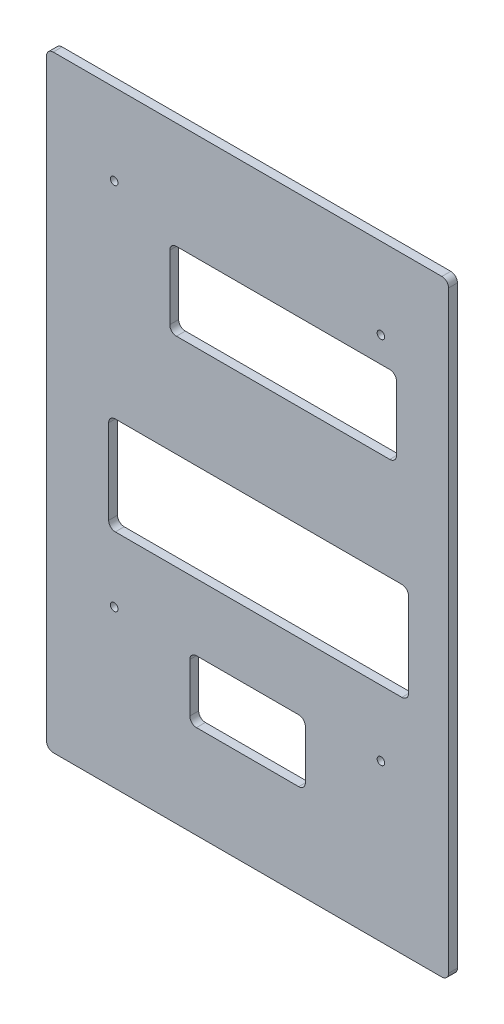
from build123d import *

# Parameters (mm, degrees)
ESQUISSE1_W             = 180.86
ESQUISSE1_H             = 273
ESQUISSE1_R             = 1.5
ESQUISSE1_W_2           = 52
ESQUISSE1_H_2           = 28
ESQUISSE1_W_3           = 134.93
ESQUISSE1_H_3           = 44
ESQUISSE1_W_4           = 102
ESQUISSE1_H_4           = 35
BOSS_EXTRU_1_DEPTH      = 4
D_GAGEMENT_M31_D        = 3.4
CONG_1_R                = 3
ESQUISSE5_R             = 2.37073369
ENL_V_MAT_EXTRU_2_DEPTH = 1


with BuildPart() as part:
    # Esquisse1 → Boss.-Extru.1 (new body)
    with BuildSketch(Plane.XY):
        with Locations((90.43, 136.5)):
            Rectangle(ESQUISSE1_W, ESQUISSE1_H)
        with Locations((30.43, 236.5)):
            Circle(ESQUISSE1_R, mode=Mode.SUBTRACT)
        with Locations((150.43, 236.5)):
            Circle(ESQUISSE1_R, mode=Mode.SUBTRACT)
        with Locations((30.43, 70.5)):
            Circle(ESQUISSE1_R, mode=Mode.SUBTRACT)
        with Locations((150.43, 70.5)):
            Circle(ESQUISSE1_R, mode=Mode.SUBTRACT)
        with Locations((90.43, 56)):
            Rectangle(ESQUISSE1_W_2, ESQUISSE1_H_2, mode=Mode.SUBTRACT)
        with Locations((95.395, 122)):
            Rectangle(ESQUISSE1_W_3, ESQUISSE1_H_3, mode=Mode.SUBTRACT)
        with Locations((106.43, 207.5)):
            Rectangle(ESQUISSE1_W_4, ESQUISSE1_H_4, mode=Mode.SUBTRACT)
    extrude(amount=BOSS_EXTRU_1_DEPTH)

    # Dégagement M31 (through all)
    with Locations(Plane.XY.offset(4)):
        with Locations((30.43, 236.5), (150.43, 236.5), (150.43, 70.5), (30.43, 70.5)):
            Hole(D_GAGEMENT_M31_D / 2)

    # Congé1
    cong_1_edges = [part.edges().sort_by_distance(p)[0] for p in [
        (0, 0, 2),
        (180.86, 0, 2),
        (116.43, 42, 2),
        (64.43, 42, 2),
        (116.43, 70, 2),
        (64.43, 70, 2),
        (162.86, 100, 2),
        (27.93, 100, 2),
        (162.86, 144, 2),
        (27.93, 144, 2),
        (180.86, 273, 2),
        (0, 273, 2),
        (157.43, 190, 2),
        (157.43, 225, 2),
        (55.43, 225, 2),
        (55.43, 190, 2),
    ]]
    fillet(cong_1_edges, radius=CONG_1_R)

    # Esquisse5 → Enlèv. mat.-Extru.2 (cut)
    # profile 1 of 11: a face of its own
    with BuildSketch(Plane(origin=(0, 0, 0), x_dir=(-1, 0, 0), z_dir=(0, 0, -1))):
        Polygon((-94.283346835, 174.034677194), (-91.185169292, 174.034677194), (-91.182359598, 166.790649968), (-88.077554099, 170.336852385), (-84.69677529, 170.336852385), (-88.331818801, 166.259366774), (-84.453541471, 160.018398975), (-87.922812939, 160.018398975), (-90.427752118, 164.343168722), (-91.182359598, 163.827233749), (-91.182359598, 160.018398975), (-94.283346835, 160.018398975), align=None)
    # profile 2 of 11: a face of its own
    with BuildSketch(Plane(origin=(0, 0, 0), x_dir=(-1, 0, 0), z_dir=(0, 0, -1))):
        with BuildLine():
            Line((-78.792459122, 174.034677194), (-75.689252185, 174.034677194))
            Line((-75.689252185, 174.034677194), (-75.689252185, 169.149539362))
            add(Edge.make_bspline(
                [(-75.689252185, 169.149539362), (-75.259442931, 169.759749882), (-73.910117231, 170.528137365), (-70.907930579, 170.723106308), (-69.542099901, 168.641576988), (-69.526370215, 167.438557264)],
                knots=[0, 0, 0, 0, 0.262740623, 0.558365338, 1, 1, 1, 1], degree=3))
            Line((-69.526370215, 167.438557264), (-69.526370215, 160.018398975))
            Line((-69.526370215, 160.018398975), (-72.624885356, 160.018398975))
            Line((-72.624885356, 160.018398975), (-72.624885356, 166.790649968))
            add(Edge.make_bspline(
                [(-75.694281579, 165.950650474), (-75.607046533, 166.608895098), (-75.198613544, 167.568039344), (-73.608769863, 168.496367369), (-72.525461974, 167.521061969), (-72.624885356, 166.790649968)],
                knots=[0, 0, 0, 0, 0.39454131, 0.596070008, 1, 1, 1, 1], degree=3))
            Line((-75.694281579, 165.950650474), (-75.694281579, 160.018398975))
            Line((-75.694281579, 160.018398975), (-78.792459122, 160.018398975))
            Line((-78.792459122, 160.018398975), (-78.792459122, 174.034677194))
        make_face()
    # profile 3 of 11: a face of its own
    with BuildSketch(Plane(origin=(0, 0, 0), x_dir=(-1, 0, 0), z_dir=(0, 0, -1))):
        with BuildLine():
            Line((-139.256891809, 172.935323872), (-137.158126377, 172.935323872))
            Line((-137.158126377, 172.935323872), (-137.158126377, 170.436793596))
            Line((-137.158126377, 170.436793596), (-133.673463028, 170.436793596))
            Line((-133.673463028, 170.436793596), (-133.673463028, 168.138145742))
            Line((-133.673463028, 168.138145742), (-137.158126377, 168.138145742))
            Line((-137.158126377, 168.138145742), (-137.158126377, 162.870364156))
            add(Edge.make_bspline(
                [(-137.158126377, 162.870364156), (-137.135735133, 162.620457218), (-136.829841883, 162.329297605), (-135.45963159, 161.948909237), (-134.22981955, 162.30663317), (-133.27943708, 162.541437923)],
                knots=[0, 0, 0, 0, 0.163675361, 0.277490049, 1, 1, 1, 1], degree=3))
            Line((-133.27943708, 162.541437923), (-133.27943708, 160.242790069))
            add(Edge.make_bspline(
                [(-133.27943708, 160.242790069), (-134.814099805, 160.050957228), (-138.701915147, 159.232331269), (-139.675674588, 161.34214339), (-139.808114513, 161.629096562), (-139.94978442, 161.926620231), (-139.975498221, 162.24161429), (-140.135507958, 164.201733563), (-140.072016369, 166.174224534), (-140.175380643, 168.138145742)],
                knots=[0, 0, 0, 0, 1, 1, 1, 2, 2, 2, 3, 3, 3, 3], degree=3))
            Line((-140.175380643, 168.138145742), (-141.753204023, 168.138145742))
            Line((-141.753204023, 168.138145742), (-141.753204023, 170.336852385))
            Line((-141.753204023, 170.336852385), (-140.023860949, 170.336852385))
            Line((-140.023860949, 170.336852385), (-139.256891809, 172.935323872))
        make_face()
    # profile 4 of 11: a face of its own
    with BuildSketch(Plane(origin=(0, 0, 0), x_dir=(-1, 0, 0), z_dir=(0, 0, -1))):
        with BuildLine():
            Line((-12.931201039, 172.935323872), (-10.932376817, 172.835382661))
            Line((-10.932376817, 172.835382661), (-10.832435606, 170.436793596))
            Line((-10.832435606, 170.436793596), (-7.434434431, 170.436793596))
            Line((-7.434434431, 170.436793596), (-7.434434431, 168.138145742))
            Line((-7.434434431, 168.138145742), (-10.932376817, 168.138145742))
            Line((-10.932376817, 168.138145742), (-10.832435606, 162.541437923))
            add(Edge.make_bspline(
                [(-7.034669586, 162.441496712), (-7.800572606, 162.237765999), (-9.055924893, 162.128236657), (-10.454489022, 162.072852708), (-10.832435606, 162.541437923)],
                knots=[0, 0, 0, 0, 0.590901675, 1, 1, 1, 1], degree=3))
            Line((-7.034669586, 162.441496712), (-7.034669586, 160.242790069))
            add(Edge.make_bspline(
                [(-7.034669586, 160.242790069), (-8.624443953, 160.067625406), (-12.469864417, 159.308373099), (-13.414156851, 161.435507228), (-13.623994546, 161.908192286), (-13.782004231, 162.4232356), (-13.791969329, 162.940307858), (-13.825996528, 164.705922314), (-13.806980244, 166.472160588), (-13.814485702, 168.238086953)],
                knots=[0, 0, 0, 0, 1, 1, 1, 2, 2, 2, 3, 3, 3, 3], degree=3))
            Line((-13.814485702, 168.238086953), (-15.440621885, 168.238086953))
            Line((-15.440621885, 168.238086953), (-15.440621885, 170.436793596))
            Line((-15.440621885, 170.436793596), (-13.716472945, 170.436793596))
            Line((-13.716472945, 170.436793596), (-12.931201039, 172.935323872))
        make_face()
    # profile 5 of 11: a face of its own
    with BuildSketch(Plane(origin=(0, 0, 0), x_dir=(-1, 0, 0), z_dir=(0, 0, -1))):
        Polygon((-174.236315677, 172.835382661), (-163.638100396, 172.835382661), (-163.638100396, 170.233513434), (-167.332675309, 170.233513434), (-167.332675309, 160.018398975), (-170.52219302, 160.018398975), (-170.570325513, 170.233513434), (-174.236315677, 170.233513434), align=None)
    # profile 6 of 11: a face of its own
    with BuildSketch(Plane(origin=(0, 0, 0), x_dir=(-1, 0, 0), z_dir=(0, 0, -1))):
        with BuildLine():
            Line((-47.213493181, 160.06614185), (-47.213493181, 172.835382661))
            Line((-47.213493181, 172.835382661), (-41.519185643, 172.835382661))
            add(Edge.make_bspline(
                [(-39.528607541, 166.790649968), (-38.956489083, 166.948005768), (-38.237437626, 167.683242131), (-37.896820407, 168.973263869), (-37.811326567, 170.127809871), (-38.284767117, 171.257641656), (-39.479973382, 172.391122107), (-40.692099064, 172.776713978), (-41.519185643, 172.835382661)],
                knots=[0, 0, 0, 0, 0.199158379, 0.317574937, 0.451003297, 0.584990763, 0.718220369, 1, 1, 1, 1], degree=3))
            add(Edge.make_bspline(
                [(-40.669958921, 160.06614185), (-39.736727743, 160.157652535), (-38.480391966, 160.846771809), (-37.259453131, 162.342559511), (-37.170137797, 163.667458124), (-37.174288807, 165.538002607), (-38.716644404, 166.479395874), (-39.528607541, 166.790649968)],
                knots=[0, 0, 0, 0, 0.282707491, 0.435580188, 0.571415841, 0.685536499, 1, 1, 1, 1], degree=3))
            Line((-40.669958921, 160.06614185), (-47.213493181, 160.06614185))
        make_face()
        with BuildLine():
            Line((-44.008657035, 167.93826332), (-44.008657035, 170.336852385))
            Line((-44.008657035, 170.336852385), (-42.174298778, 170.336852385))
            add(Edge.make_bspline(
                [(-42.049794824, 167.93826332), (-41.669827031, 167.927070476), (-41.248589309, 168.346380324), (-41.07437401, 169.11731054), (-41.21655482, 169.96394874), (-41.825514646, 170.299249739), (-42.174298778, 170.336852385)],
                knots=[0, 0, 0, 0, 0.294874779, 0.472371571, 0.685290478, 1, 1, 1, 1], degree=3))
            Line((-42.049794824, 167.93826332), (-44.008657035, 167.93826332))
        make_face(mode=Mode.SUBTRACT)
        with BuildLine():
            Line((-44.026733029, 165.464806319), (-44.026733029, 162.541437923))
            Line((-44.026733029, 162.541437923), (-41.810545792, 162.541437923))
            ThreePointArc((-41.810545792, 162.541437923), (-40.348861594, 164.003122121), (-41.810545792, 165.464806319))
            Line((-41.810545792, 165.464806319), (-44.026733029, 165.464806319))
        make_face(mode=Mode.SUBTRACT)
    # profile 7 of 11: a face of its own
    with BuildSketch(Plane(origin=(0, 0, 0), x_dir=(-1, 0, 0), z_dir=(0, 0, -1))):
        with BuildLine():
            Line((-27.522617852, 172.135794184), (-25.223969998, 172.035852973))
            Line((-25.223969998, 172.035852973), (-24.924146365, 170.636676018))
            add(Edge.make_bspline(
                [(-24.924146365, 170.636676018), (-23.547713892, 170.177865194), (-23.893594467, 170.424239717), (-22.825380933, 171.136382073)],
                knots=[0, 0, 0, 0, 1, 1, 1, 1], degree=3))
            Line((-22.825380933, 171.136382073), (-21.149702282, 169.437381485))
            Line((-21.149702282, 169.437381485), (-22.045562011, 168.238086953))
            Line((-22.045562011, 168.238086953), (-21.633263005, 167.328340687))
            Line((-21.633263005, 167.328340687), (-20.226909445, 167.138733631))
            Line((-20.226909445, 167.138733631), (-20.326850656, 164.840085777))
            Line((-20.326850656, 164.840085777), (-21.726027611, 164.540262144))
            add(Edge.make_bspline(
                [(-21.726027611, 164.540262144), (-22.206613971, 163.098503063), (-21.903336346, 163.59564387), (-21.326262767, 162.441496712)],
                knots=[0, 0, 0, 0, 1, 1, 1, 1], degree=3))
            Line((-21.326262767, 162.441496712), (-22.925322144, 160.842437335))
            Line((-22.925322144, 160.842437335), (-24.124616676, 161.641967023))
            Line((-24.124616676, 161.641967023), (-25.024087576, 161.242202179))
            Line((-25.024087576, 161.242202179), (-25.323911209, 159.843025224))
            Line((-25.323911209, 159.843025224), (-27.522617852, 159.942966435))
            Line((-27.522617852, 159.942966435), (-27.822441485, 161.34214339))
            add(Edge.make_bspline(
                [(-27.822441485, 161.34214339), (-28.799212683, 161.667733789), (-28.555204575, 161.758652056), (-29.22161844, 161.34214339), (-29.449377161, 161.19979419), (-29.688010758, 161.075633494), (-29.921206917, 160.942378546)],
                knots=[0, 0, 0, 0, 1, 1, 1, 2, 2, 2, 2], degree=3))
            Line((-29.921206917, 160.942378546), (-31.520266294, 162.541437923))
            Line((-31.520266294, 162.541437923), (-30.720736606, 163.740732455))
            Line((-30.720736606, 163.740732455), (-31.12050145, 164.640203355))
            Line((-31.12050145, 164.640203355), (-32.519678405, 164.940026988))
            Line((-32.519678405, 164.940026988), (-32.419737194, 167.138733631))
            Line((-32.419737194, 167.138733631), (-31.020560239, 167.438557264))
            Line((-31.020560239, 167.438557264), (-30.720736606, 168.338028164))
            Line((-30.720736606, 168.338028164), (-31.520266294, 169.537322696))
            Line((-31.520266294, 169.537322696), (-29.921206917, 171.036440862))
            add(Edge.make_bspline(
                [(-29.921206917, 171.036440862), (-29.494314144, 170.894143271), (-29.168603613, 170.386484744), (-28.721912385, 170.336852385), (-28.380115397, 170.298874942), (-28.120867147, 170.537200797), (-27.822441485, 170.636676018)],
                knots=[0, 0, 0, 0, 1, 1, 1, 2, 2, 2, 2], degree=3))
            Line((-27.822441485, 170.636676018), (-27.522617852, 172.135794184))
        make_face()
        with Locations((-26.386833531, 165.983241371)):
            Circle(ESQUISSE5_R, mode=Mode.SUBTRACT)
    # profile 8 of 11: a face of its own
    with BuildSketch(Plane(origin=(0, 0, 0), x_dir=(-1, 0, 0), z_dir=(0, 0, -1))):
        Polygon((-121.36741503, 171.73602934), (-113.272176935, 160.142848858), (-130.162241603, 160.242790069), align=None)
        Polygon((-122.8784515, 167.733423277), (-124.965298628, 161.242202179), (-127.96353496, 161.34214339), align=None, mode=Mode.SUBTRACT)
        Polygon((-121.267473819, 169.437381485), (-115.470883578, 161.34214339), (-123.666062884, 161.34214339), align=None, mode=Mode.SUBTRACT)
    # profile 9 of 11: a face of its own
    with BuildSketch(Plane(origin=(0, 0, 0), x_dir=(-1, 0, 0), z_dir=(0, 0, -1))):
        with BuildLine():
            Line((-101.1220469, 160.018398975), (-104.165968477, 160.018398975))
            Line((-104.165968477, 160.018398975), (-104.165968477, 165.950650474))
            add(Edge.make_bspline(
                [(-107.272446663, 165.950650474), (-107.246526147, 166.745002821), (-106.276228736, 168.588199152), (-104.043085613, 167.741682876), (-104.204058368, 166.455663269), (-104.165968477, 165.950650474)],
                knots=[0, 0, 0, 0, 0.496685, 0.694227188, 1, 1, 1, 1], degree=3))
            Line((-107.272446663, 165.950650474), (-107.272446663, 160.018398975))
            Line((-107.272446663, 160.018398975), (-110.373881815, 160.018398975))
            Line((-110.373881815, 160.018398975), (-110.373881815, 170.436793596))
            Line((-110.373881815, 170.436793596), (-107.470999641, 170.436793596))
            Line((-107.470999641, 170.436793596), (-107.470999641, 169.149539362))
            Line((-107.470999641, 169.149539362), (-107.272446663, 169.149539362))
            add(Edge.make_bspline(
                [(-107.272446663, 169.149539362), (-106.858538525, 169.829859962), (-105.517894499, 170.598013205), (-103.520232225, 170.635762217), (-101.657211683, 169.687420486), (-101.152134581, 168.286093678), (-101.1220469, 167.438557264)],
                knots=[0, 0, 0, 0, 0.278640188, 0.525252243, 0.687769466, 1, 1, 1, 1], degree=3))
            Line((-101.1220469, 167.438557264), (-101.1220469, 160.018398975))
        make_face()
    # profile 10 of 11: a face of its own
    with BuildSketch(Plane(origin=(0, 0, 0), x_dir=(-1, 0, 0), z_dir=(0, 0, -1))):
        with BuildLine():
            Line((-55.536124826, 159.942966435), (-54.05995465, 159.942966435))
            add(Edge.make_bspline(
                [(-54.05995465, 159.942966435), (-53.508105979, 160.01579836), (-53.000836715, 160.242790069)],
                knots=[0, 0, 0, 1, 1, 1], degree=2))
            Line((-53.000836715, 160.242790069), (-53.000836715, 162.127229521))
            add(Edge.make_bspline(
                [(-54.414465889, 162.65067545), (-54.397822189, 162.444945707), (-54.131217592, 161.731860695), (-53.322133646, 162.037641941), (-53.000836715, 162.127229521)],
                knots=[0, 0, 0, 0, 0.373122237, 1, 1, 1, 1], degree=3))
            Line((-54.414465889, 162.65067545), (-54.414465889, 167.006083276))
            add(Edge.make_bspline(
                [(-54.414465889, 167.006083276), (-54.386504145, 167.621449135), (-54.651940285, 168.602619281), (-55.530786964, 169.638124659), (-56.720166972, 170.506789896), (-57.883902376, 170.537080698), (-58.570212672, 170.576762938)],
                knots=[0, 0, 0, 0, 0.300061028, 0.469139707, 0.655769187, 1, 1, 1, 1], degree=3))
            add(Edge.make_bspline(
                [(-62.909353069, 167.1387297), (-62.863627032, 167.85106608), (-62.159984886, 169.942717077), (-59.815362212, 170.602349771), (-58.570212672, 170.576762938)],
                knots=[0, 0, 0, 0, 0.353066215, 1, 1, 1, 1], degree=3))
            Line((-62.909353069, 167.1387297), (-59.710062437, 167.03879242))
            add(Edge.make_bspline(
                [(-59.710062437, 167.03879242), (-59.772976556, 167.453131763), (-59.351848428, 168.878548654), (-57.474509929, 168.363912338), (-57.481549229, 167.328340687)],
                knots=[0, 0, 0, 0, 0.367002115, 1, 1, 1, 1], degree=3))
            Line((-57.481549229, 167.328340687), (-57.481549229, 166.539441837))
            add(Edge.make_bspline(
                [(-57.086432706, 161.34214339), (-57.377446818, 161.051649381), (-57.819055658, 160.557721707), (-58.186679465, 160.343714944), (-59.360706767, 159.660272315), (-61.06795204, 159.627086373), (-62.184236921, 160.447231624), (-63.701766095, 161.562174922), (-63.671428161, 164.622806523), (-62.079647588, 165.644083132), (-60.725568887, 166.512851686), (-59.002445589, 166.423818059), (-57.481549229, 166.539441837)],
                knots=[0, 0, 0, 0, 1, 1, 1, 2, 2, 2, 3, 3, 3, 4, 4, 4, 4], degree=3))
            add(Edge.make_bspline(
                [(-57.086432706, 161.34214339), (-56.941883806, 160.602544997), (-56.244905873, 160.079915331), (-55.536124826, 159.942966435)],
                knots=[0, 0, 0, 0, 1, 1, 1, 1], degree=3))
        make_face()
        with BuildLine():
            Line((-57.504981168, 164.540262144), (-59.142188105, 164.540262144))
            ThreePointArc((-59.142188105, 164.540262144), (-59.761878777, 164.313650273), (-60.089193064, 163.740732455))
            Line((-60.089193064, 163.740732455), (-60.089193064, 162.870364156))
            add(Edge.make_bspline(
                [(-57.504981168, 163.827233749), (-57.530560699, 163.319345142), (-57.998402486, 162.551066292), (-59.183910763, 162.12566475), (-60.062059738, 162.268391521), (-60.089193064, 162.870364156)],
                knots=[0, 0, 0, 0, 0.406446969, 0.637071772, 1, 1, 1, 1], degree=3))
            Line((-57.504981168, 163.827233749), (-57.504981168, 164.540262144))
        make_face(mode=Mode.SUBTRACT)
    # profile 11 of 11: a face of its own
    with BuildSketch(Plane(origin=(0, 0, 0), x_dir=(-1, 0, 0), z_dir=(0, 0, -1))):
        with BuildLine():
            Line((-157.743373817, 170.336852385), (-154.691660567, 170.35202095))
            Line((-154.691660567, 170.35202095), (-154.691660567, 164.305357131))
            add(Edge.make_bspline(
                [(-154.691660567, 164.305357131), (-154.739400236, 163.733239021), (-154.544395693, 163.005941624), (-153.763344575, 162.177589551), (-152.873479584, 162.373329578), (-152.034409307, 163.044126987), (-151.856832613, 163.856575061), (-151.804866228, 164.305357131)],
                knots=[0, 0, 0, 0, 0.303186939, 0.415254368, 0.583999264, 0.737935454, 1, 1, 1, 1], degree=3))
            Line((-151.804866228, 164.305357131), (-151.804866228, 170.35202095))
            Line((-151.804866228, 170.35202095), (-148.751306859, 170.336852385))
            Line((-148.751306859, 170.336852385), (-148.647259476, 160.018398975))
            Line((-148.647259476, 160.018398975), (-151.62161785, 160.018398975))
            Line((-151.62161785, 160.018398975), (-151.62161785, 161.426937785))
            add(Edge.make_bspline(
                [(-151.62161785, 161.426937785), (-151.917216442, 161.122947828), (-152.172795278, 160.774098664), (-152.508413627, 160.514967913), (-152.744262162, 160.332869384), (-153.020940607, 160.202225705), (-153.302270784, 160.104053727), (-155.63936652, 159.28850911), (-157.550929713, 160.797221628), (-157.644076002, 163.241721213), (-157.734138136, 165.60528128), (-157.710274545, 167.971808661), (-157.743373817, 170.336852385)],
                knots=[0, 0, 0, 0, 1, 1, 1, 2, 2, 2, 3, 3, 3, 4, 4, 4, 4], degree=3))
        make_face()
    extrude(amount=-ENL_V_MAT_EXTRU_2_DEPTH, mode=Mode.SUBTRACT)


solid = part.part
